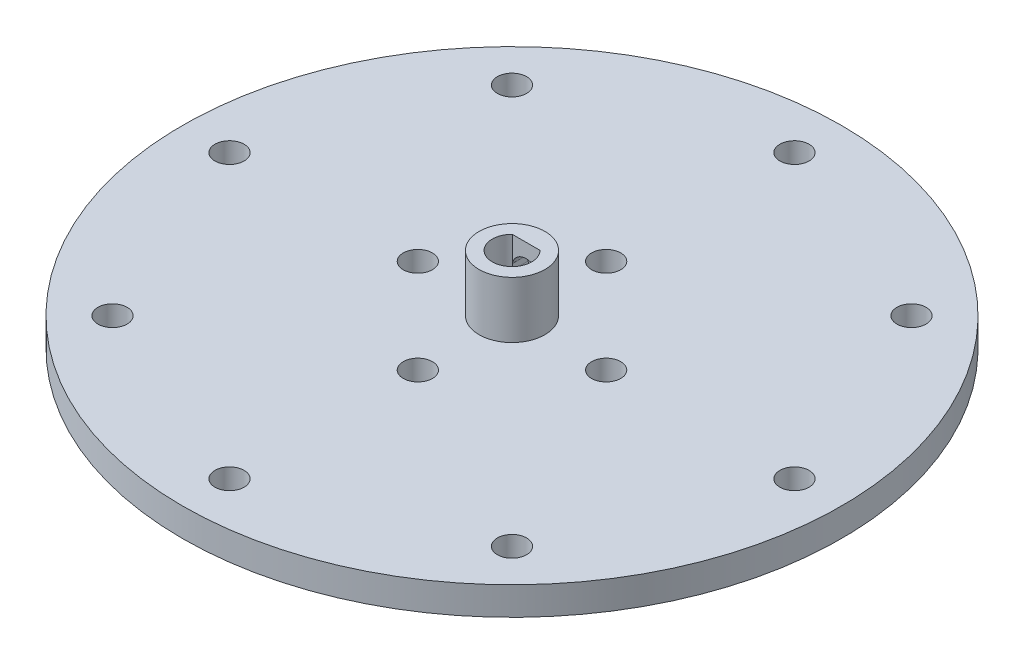
from build123d import *
from build123d.topology import SkipClean

# Parameters (mm, degrees)
SKETCH_1_R          = 35
EXTRUDE_1_DEPTH     = 3
CUT_EXTRUDE_1_DEPTH = 3
EXTRUDE_START       = 6
SKETCH_3_R          = 3.5
EXTRUDE_2_DEPTH     = 6
CUT_EXTRUDE_2_DEPTH = 6
SKETCH_5_R          = 1.55
CUT_EXTRUDE_3_DEPTH = 6


with BuildPart() as part:
    # 草图1 → 凸台-拉伸1 (new body)
    with BuildSketch(Plane(origin=(0, 0, 0), x_dir=(1, 0, 0), z_dir=(0, 1, 0))):
        Circle(SKETCH_1_R)
    extrude(amount=EXTRUDE_1_DEPTH)

    # 草图2 → 切除-拉伸1 (cut)
    with BuildSketch(Plane(origin=(0, 3, 0), x_dir=(1, 0, 0), z_dir=(0, 1, 0))):
        with BuildLine():
            Line((0, 1.5), (-1.469693846, 1.5))
            ThreePointArc((-1.469693846, 1.5), (-0.8135241, -1.936021317), (2.1, 0))
            ThreePointArc((2.1, 0), (1.936021317, 0.8135241), (1.469693846, 1.5))
            Line((1.469693846, 1.5), (0, 1.5))
        make_face()
    extrude(amount=-CUT_EXTRUDE_1_DEPTH, mode=Mode.SUBTRACT)

    # 草图3 → 凸台-拉伸2 (add)
    with BuildSketch(Plane(origin=(0, 3, 0), x_dir=(1, 0, 0), z_dir=(0, 1, 0)).offset(EXTRUDE_START)):
        Circle(SKETCH_3_R)
        with BuildLine():
            ThreePointArc((1.469693846, 1.5), (0, -2.1), (-1.469693846, 1.5))
            Line((-1.469693846, 1.5), (1.469693846, 1.5))
        make_face(mode=Mode.SUBTRACT)
    extrude(amount=-EXTRUDE_2_DEPTH)

    # 草图4 → 切除-拉伸2 (cut)
    with BuildSketch(Plane.XY.offset(-1.5)):
        with BuildLine():
            Line((1.469693846, 5.7), (1.469693846, 6.3))
            ThreePointArc((1.469693846, 6.3), (0.948683298, 7.161895004), (0, 7.5))
            ThreePointArc((0, 7.5), (-0.948683298, 7.161895004), (-1.469693846, 6.3))
            Line((-1.469693846, 6.3), (-1.469693846, 5.7))
            ThreePointArc((-1.469693846, 5.7), (0, 4.5), (1.469693846, 5.7))
        make_face()
    extrude(amount=-CUT_EXTRUDE_2_DEPTH, mode=Mode.SUBTRACT)

    # 草图5 → 切除-拉伸3 (cut)
    with SkipClean():  # the faces are left unmerged after this step: merging them gives an invalid solid
        with BuildSketch(Plane(origin=(0, 3, 0), x_dir=(1, 0, 0), z_dir=(0, 1, 0))):
            with Locations((0, 30)):
                Circle(SKETCH_5_R)
            with Locations((0, 10)):
                Circle(SKETCH_5_R)
            with Locations((30, 0)):
                Circle(SKETCH_5_R)
            with Locations((10, 0)):
                Circle(SKETCH_5_R)
            with Locations((0, -30)):
                Circle(SKETCH_5_R)
            with Locations((0, -10)):
                Circle(SKETCH_5_R)
            with Locations((-10, 0)):
                Circle(SKETCH_5_R)
            with Locations((-30, 0)):
                Circle(SKETCH_5_R)
            with Locations((21.213203436, 21.213203436)):
                Circle(SKETCH_5_R)
            with Locations((21.213203436, -21.213203436)):
                Circle(SKETCH_5_R)
            with Locations((-21.213203436, -21.213203436)):
                Circle(SKETCH_5_R)
            with Locations((-21.213203436, 21.213203436)):
                Circle(SKETCH_5_R)
        extrude(amount=-CUT_EXTRUDE_3_DEPTH, mode=Mode.SUBTRACT)


solid = part.part
